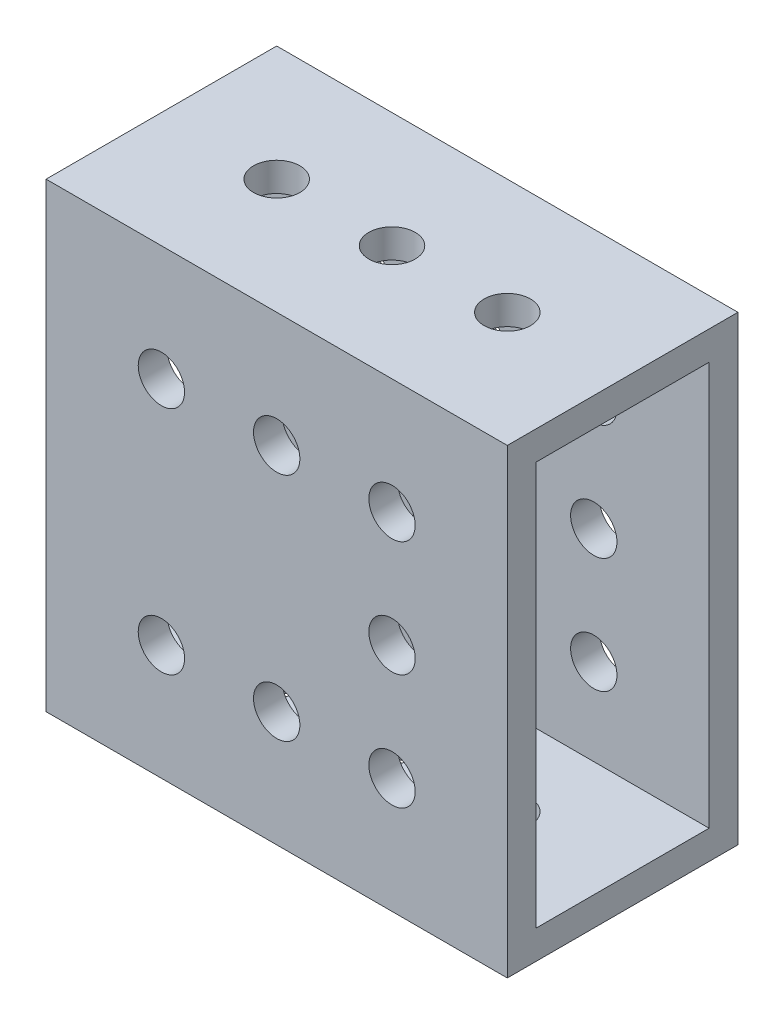
from build123d import *

# Parameters (mm, degrees)
SKETCH1_W           = 50.8
SKETCH1_H           = 50.8
BOSS_EXTRUDE1_DEPTH = 25.4
SKETCH2_W           = 19.05
SKETCH2_H           = 44.45
CUT_EXTRUDE1_DEPTH  = 77.2
SKETCH3_R           = 2.5527
CUT_EXTRUDE2_DEPTH  = 77.2
SKETCH4_R           = 2.5527
CUT_EXTRUDE3_DEPTH  = 77.2


with BuildPart() as part:
    # Sketch1 → Boss-Extrude1 (new body)
    with BuildSketch(Plane.XY):
        with Locations((25.4, 25.4)):
            Rectangle(SKETCH1_W, SKETCH1_H)
    extrude(amount=BOSS_EXTRUDE1_DEPTH)

    # Sketch2 → Cut-Extrude1 (cut, through all)
    with BuildSketch(Plane(origin=(50.8, 0, 0), x_dir=(0, 0, -1), z_dir=(1, 0, 0))):
        with Locations((-12.7, 25.4)):
            Rectangle(SKETCH2_W, SKETCH2_H)
    extrude(amount=-CUT_EXTRUDE1_DEPTH, mode=Mode.SUBTRACT)

    # Sketch3 → Cut-Extrude2 (cut, through all)
    with BuildSketch(Plane(origin=(0, 50.8, 0), x_dir=(1, 0, 0), z_dir=(0, 1, 0))):
        with Locations((12.7, -12.7)):
            Circle(SKETCH3_R)
        with Locations((25.4, -12.7)):
            Circle(SKETCH3_R)
        with Locations((38.1, -12.7)):
            Circle(SKETCH3_R)
    extrude(amount=-CUT_EXTRUDE2_DEPTH, mode=Mode.SUBTRACT)

    # Sketch4 → Cut-Extrude3 (cut, through all)
    with BuildSketch(Plane(origin=(0, 0, 0), x_dir=(-1, 0, 0), z_dir=(0, 0, -1))):
        with Locations((-38.1, 38.1)):
            Circle(SKETCH4_R)
        with Locations((-25.4, 38.1)):
            Circle(SKETCH4_R)
        with Locations((-12.7, 38.1)):
            Circle(SKETCH4_R)
        with Locations((-38.1, 12.7)):
            Circle(SKETCH4_R)
        with Locations((-25.4, 12.7)):
            Circle(SKETCH4_R)
        with Locations((-12.7, 12.7)):
            Circle(SKETCH4_R)
        with Locations((-38.1, 25.4)):
            Circle(SKETCH4_R)
    extrude(amount=-CUT_EXTRUDE3_DEPTH, mode=Mode.SUBTRACT)


solid = part.part
